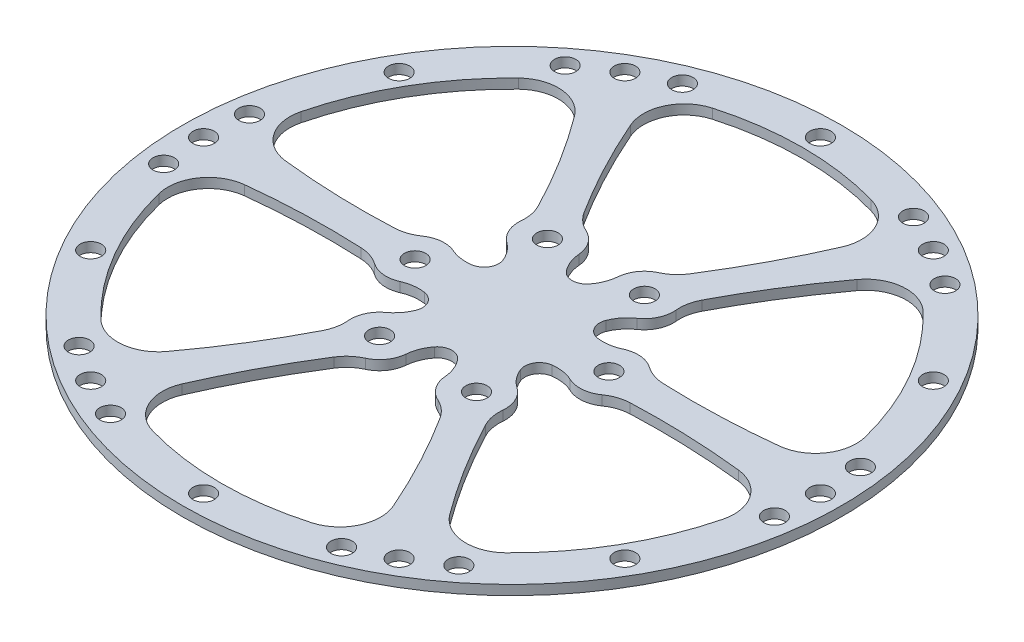
from build123d import *

# Parameters (mm, degrees)
SKETCH1_R           = 34
SKETCH1_R_2         = 1.1
BOSS_EXTRUDE1_DEPTH = 1
CUT_EXTRUDE3_DEPTH  = 1
SKETCH3_R           = 3
SKETCH3_R_2         = 1.1
BOSS_EXTRUDE2_DEPTH = 1
FILLET3_R           = 1.5
FILLET4_R           = 1.5
FILLET5_R           = 1.5
FILLET6_R           = 1.5
FILLET7_R           = 1.5
FILLET8_R           = 1.5
FILLET9_R           = 4.2
FILLET10_DEPTH      = 1
SKETCH4_R           = 1.1
CUT_EXTRUDE5_DEPTH  = 1


with BuildPart() as part:
    # Sketch1 → Boss-Extrude1 (new body)
    with BuildSketch(Plane(origin=(0, 0, 0), x_dir=(1, 0, 0), z_dir=(0, 1, 0))):
        with Locations(Location((0, 0, 0), (0, 0, 270))):
            Circle(SKETCH1_R)
        with BuildLine():
            Line((29.874495302, 2.74126439), (4.752791338, 2.743469217))
            Line((4.752791338, 2.743469217), (17.315552753, 24.498400618))
            ThreePointArc((17.315552753, 24.498400618), (25.982078498, 14.997719724), (29.874495302, 2.74126439))
        make_face(mode=Mode.SUBTRACT)
        with BuildLine():
            Line((12.56324305, 27.242704052), (0.000481633, 5.487772646))
            Line((0.000481633, 5.487772646), (-12.558460911, 27.244908874))
            ThreePointArc((-12.558460911, 27.244908874), (0.002632969, 29.999999884), (12.56324305, 27.242704052))
        make_face(mode=Mode.SUBTRACT)
        with BuildLine():
            Line((-17.311252251, 24.501439661), (-4.752309705, 2.744303429))
            Line((-4.752309705, 2.744303429), (-29.874013664, 2.746508256))
            ThreePointArc((-29.874013664, 2.746508256), (-25.979445529, 15.00228016), (-17.311252251, 24.501439661))
        make_face(mode=Mode.SUBTRACT)
        with BuildLine():
            Line((-29.874495302, -2.74126439), (-4.752791338, -2.743469217))
            Line((-4.752791338, -2.743469217), (-17.315552753, -24.498400618))
            ThreePointArc((-17.315552753, -24.498400618), (-25.982078498, -14.997719724), (-29.874495302, -2.74126439))
        make_face(mode=Mode.SUBTRACT)
        with BuildLine():
            Line((-12.56324305, -27.242704052), (-0.000481633, -5.487772646))
            Line((-0.000481633, -5.487772646), (12.558460911, -27.244908874))
            ThreePointArc((12.558460911, -27.244908874), (-0.002632969, -29.999999884), (-12.56324305, -27.242704052))
        make_face(mode=Mode.SUBTRACT)
        with BuildLine():
            Line((17.311252251, -24.501439661), (4.752309705, -2.744303429))
            Line((4.752309705, -2.744303429), (29.874013664, -2.746508256))
            ThreePointArc((29.874013664, -2.746508256), (25.979445529, -15.00228016), (17.311252251, -24.501439661))
        make_face(mode=Mode.SUBTRACT)
        with Locations(Location((-19.590228091, -25.074348518, 0), (0, 0, 270))):
            Circle(SKETCH1_R_2, mode=Mode.SUBTRACT)
        with Locations(Location((-15.9099025, -27.556759473, 0), (0, 0, 270))):
            Circle(SKETCH1_R_2, mode=Mode.SUBTRACT)
        with Locations(Location((-11.919908754, -29.502809451, 0), (0, 0, 270))):
            Circle(SKETCH1_R_2, mode=Mode.SUBTRACT)
        with Locations(Location((-27.556759473, -15.9099025, 0), (0, 0, 270))):
            Circle(SKETCH1_R_2, mode=Mode.SUBTRACT)
        with Locations(Location((-31.510136845, -4.428460934, 0), (0, 0, 270))):
            Circle(SKETCH1_R_2, mode=Mode.SUBTRACT)
        with Locations(Location((0, -31.819805, 0), (0, 0, 270))):
            Circle(SKETCH1_R_2, mode=Mode.SUBTRACT)
        with Locations(Location((11.919908754, -29.502809451, 0), (0, 0, 270))):
            Circle(SKETCH1_R_2, mode=Mode.SUBTRACT)
        with Locations(Location((15.9099025, -27.556759473, 0), (0, 0, 270))):
            Circle(SKETCH1_R_2, mode=Mode.SUBTRACT)
        with Locations(Location((19.590228091, -25.074348518, 0), (0, 0, 270))):
            Circle(SKETCH1_R_2, mode=Mode.SUBTRACT)
        with Locations(Location((27.556759473, -15.9099025, 0), (0, 0, 270))):
            Circle(SKETCH1_R_2, mode=Mode.SUBTRACT)
        with Locations(Location((31.510136845, -4.428460934, 0), (0, 0, 270))):
            Circle(SKETCH1_R_2, mode=Mode.SUBTRACT)
        with Locations(Location((31.819805, 0, 0), (0, 0, 270))):
            Circle(SKETCH1_R_2, mode=Mode.SUBTRACT)
        with Locations(Location((-31.819805, 0, 0), (0, 0, 270))):
            Circle(SKETCH1_R_2, mode=Mode.SUBTRACT)
        with Locations(Location((-31.510136845, 4.428460934, 0), (0, 0, 270))):
            Circle(SKETCH1_R_2, mode=Mode.SUBTRACT)
        with Locations(Location((-27.556759473, 15.9099025, 0), (0, 0, 270))):
            Circle(SKETCH1_R_2, mode=Mode.SUBTRACT)
        with Locations(Location((-19.590228091, 25.074348518, 0), (0, 0, 270))):
            Circle(SKETCH1_R_2, mode=Mode.SUBTRACT)
        with Locations(Location((-15.9099025, 27.556759473, 0), (0, 0, 270))):
            Circle(SKETCH1_R_2, mode=Mode.SUBTRACT)
        with Locations(Location((-11.919908754, 29.502809451, 0), (0, 0, 270))):
            Circle(SKETCH1_R_2, mode=Mode.SUBTRACT)
        with Locations(Location((0, 31.819805, 0), (0, 0, 270))):
            Circle(SKETCH1_R_2, mode=Mode.SUBTRACT)
        with Locations(Location((27.556759473, 15.9099025, 0), (0, 0, 270))):
            Circle(SKETCH1_R_2, mode=Mode.SUBTRACT)
        with Locations(Location((31.510136845, 4.428460934, 0), (0, 0, 270))):
            Circle(SKETCH1_R_2, mode=Mode.SUBTRACT)
        with Locations(Location((11.919908754, 29.502809451, 0), (0, 0, 270))):
            Circle(SKETCH1_R_2, mode=Mode.SUBTRACT)
        with Locations(Location((19.590228091, 25.074348518, 0), (0, 0, 270))):
            Circle(SKETCH1_R_2, mode=Mode.SUBTRACT)
        with Locations(Location((15.9099025, 27.556759473, 0), (0, 0, 270))):
            Circle(SKETCH1_R_2, mode=Mode.SUBTRACT)
    extrude(amount=BOSS_EXTRUDE1_DEPTH)

    # Sketch2 → Cut-Extrude3 (cut)
    with BuildSketch(Plane(origin=(0, 1, 0), x_dir=(1, 0, 0), z_dir=(0, 1, 0))):
        with BuildLine():
            Line((-29.874013664, 2.746508256), (-17.311252251, 24.501439661))
            add(Edge.make_bspline(
                [(-17.311252251, 24.501439661), (-9.126466195, 14.703908303), (-4.752309705, 2.744303429)],
                knots=[0, 0, 0, 1, 1, 1], degree=2))
            add(Edge.make_bspline(
                [(-29.874013664, 2.746508256), (-17.29686175, 0.57909925), (-4.752309705, 2.744303429)],
                knots=[0, 0, 0, 1, 1, 1], degree=2))
        make_face()
        with BuildLine():
            Line((-12.558460911, 27.244908874), (12.56324305, 27.242704052))
            add(Edge.make_bspline(
                [(12.56324305, 27.242704052), (8.0904088, 15.224614872), (0, 5.31022313)],
                knots=[0, 0, 0, 1, 1, 1], degree=2))
            add(Edge.make_bspline(
                [(-12.558460911, 27.244908874), (-8.092420686, 15.223623734), (0, 5.31022313)],
                knots=[0, 0, 0, 1, 1, 1], degree=2))
        make_face()
        with BuildLine():
            Line((17.315552753, 24.498400618), (29.874495302, 2.74126439))
            add(Edge.make_bspline(
                [(29.874495302, 2.74126439), (17.230107642, 0.605807888), (4.598788131, 2.655111565)],
                knots=[0, 0, 0, 1, 1, 1], degree=2))
            add(Edge.make_bspline(
                [(17.315552753, 24.498400618), (9.137834548, 14.620053759), (4.598788131, 2.655111565)],
                knots=[0, 0, 0, 1, 1, 1], degree=2))
        make_face()
        with BuildLine():
            Line((29.874013664, -2.746508256), (17.311252251, -24.501439661))
            add(Edge.make_bspline(
                [(17.311252251, -24.501439661), (9.139698842, -14.618806983), (4.598788131, -2.655111565)],
                knots=[0, 0, 0, 1, 1, 1], degree=2))
            add(Edge.make_bspline(
                [(29.874013664, -2.746508256), (17.230255234, -0.603569975), (4.598788131, -2.655111565)],
                knots=[0, 0, 0, 1, 1, 1], degree=2))
        make_face()
        with BuildLine():
            Line((12.558460911, -27.244908874), (-12.56324305, -27.242704052))
            add(Edge.make_bspline(
                [(-12.56324305, -27.242704052), (-8.0904088, -15.224614872), (0, -5.31022313)],
                knots=[0, 0, 0, 1, 1, 1], degree=2))
            add(Edge.make_bspline(
                [(12.558460911, -27.244908874), (8.092420686, -15.223623734), (0, -5.31022313)],
                knots=[0, 0, 0, 1, 1, 1], degree=2))
        make_face()
        with BuildLine():
            Line((-17.315552753, -24.498400618), (-29.874495302, -2.74126439))
            add(Edge.make_bspline(
                [(-29.874495302, -2.74126439), (-17.296953851, -0.574908868), (-4.752791338, -2.743469217)],
                knots=[0, 0, 0, 1, 1, 1], degree=2))
            add(Edge.make_bspline(
                [(-17.315552753, -24.498400618), (-9.124043467, -14.705102948), (-4.752791338, -2.743469217)],
                knots=[0, 0, 0, 1, 1, 1], degree=2))
        make_face()
    extrude(amount=-CUT_EXTRUDE3_DEPTH, mode=Mode.SUBTRACT)

    # Sketch3 → Boss-Extrude2 (add)
    # profile 1 of 6: a face of its own
    with BuildSketch(Plane(origin=(0, 1, 0), x_dir=(1, 0, 0), z_dir=(0, 1, 0))):
        with Locations((-10, 0)):
            Circle(SKETCH3_R)
        with Locations((-10, 0)):
            Circle(SKETCH3_R_2, mode=Mode.SUBTRACT)
    # profile 2 of 6: a face of its own
    with BuildSketch(Plane(origin=(0, 1, 0), x_dir=(1, 0, 0), z_dir=(0, 1, 0))):
        with Locations((-5, 8.660254038)):
            Circle(SKETCH3_R)
        with Locations((-5, 8.660254038)):
            Circle(SKETCH3_R_2, mode=Mode.SUBTRACT)
    # profile 3 of 6: a face of its own
    with BuildSketch(Plane(origin=(0, 1, 0), x_dir=(1, 0, 0), z_dir=(0, 1, 0))):
        with Locations((5, 8.660254038)):
            Circle(SKETCH3_R)
        with Locations((5, 8.660254038)):
            Circle(SKETCH3_R_2, mode=Mode.SUBTRACT)
    # profile 4 of 6: a face of its own
    with BuildSketch(Plane(origin=(0, 1, 0), x_dir=(1, 0, 0), z_dir=(0, 1, 0))):
        with Locations((10, 0)):
            Circle(SKETCH3_R)
        with Locations((10, 0)):
            Circle(SKETCH3_R_2, mode=Mode.SUBTRACT)
    # profile 5 of 6: a face of its own
    with BuildSketch(Plane(origin=(0, 1, 0), x_dir=(1, 0, 0), z_dir=(0, 1, 0))):
        with Locations((5, -8.660254038)):
            Circle(SKETCH3_R)
        with Locations((5, -8.660254038)):
            Circle(SKETCH3_R_2, mode=Mode.SUBTRACT)
    # profile 6 of 6: a face of its own
    with BuildSketch(Plane(origin=(0, 1, 0), x_dir=(1, 0, 0), z_dir=(0, 1, 0))):
        with Locations((-5, -8.660254038)):
            Circle(SKETCH3_R)
        with Locations((-5, -8.660254038)):
            Circle(SKETCH3_R_2, mode=Mode.SUBTRACT)
    extrude(amount=-BOSS_EXTRUDE2_DEPTH)

    # Fillet3
    fillet3_edges = [part.edges().sort_by_distance(p)[0] for p in [
        (0, 0.5, 5.31022313),
    ]]
    fillet(fillet3_edges, radius=FILLET3_R)

    # Fillet4
    fillet4_edges = [part.edges().sort_by_distance(p)[0] for p in [
        (4.598788131, 0.5, 2.655111565),
    ]]
    fillet(fillet4_edges, radius=FILLET4_R)

    # Fillet5
    fillet5_edges = [part.edges().sort_by_distance(p)[0] for p in [
        (4.598788131, 0.5, -2.655111565),
    ]]
    fillet(fillet5_edges, radius=FILLET5_R)

    # Fillet6
    fillet6_edges = [part.edges().sort_by_distance(p)[0] for p in [
        (0, 0.5, -5.31022313),
    ]]
    fillet(fillet6_edges, radius=FILLET6_R)

    # Fillet7
    fillet7_edges = [part.edges().sort_by_distance(p)[0] for p in [
        (-4.752309705, 0.5, -2.744303429),
    ]]
    fillet(fillet7_edges, radius=FILLET7_R)

    # Fillet8
    fillet8_edges = [part.edges().sort_by_distance(p)[0] for p in [
        (-4.752791338, 0.5, 2.743469217),
    ]]
    fillet(fillet8_edges, radius=FILLET8_R)

    # Fillet9
    fillet9_edges = [part.edges().sort_by_distance(p)[0] for p in [
        (12.558460911, 0.5, 27.244908874),
        (-17.315552753, 0.5, 24.498400618),
        (29.874013664, 0.5, 2.746508256),
        (-12.56324305, 0.5, 27.242704052),
        (17.311252251, 0.5, 24.501439661),
        (29.874495302, 0.5, -2.74126439),
        (12.56324305, 0.5, -27.242704052),
        (17.315552753, 0.5, -24.498400618),
        (-29.874495302, 0.5, 2.74126439),
        (-29.874013664, 0.5, -2.746508256),
        (-17.311252251, 0.5, -24.501439661),
        (-12.558460911, 0.5, -27.244908874),
    ]]
    fillet(fillet9_edges, radius=FILLET9_R)

    # Fillet10: read off the stored shape, not the designer's step
    # Fillet10 outline → Fillet10 (add)
    with BuildSketch(Plane(origin=(0, 0, 0), x_dir=(1, 0, 0), z_dir=(0, 1, 0))):
        with BuildLine():
            ThreePointArc((-8.415590155, 11.113962409), (-8.046523611, 10.051029707), (-7.988084905, 8.927365629))
            ThreePointArc((-7.988084905, 8.927365629), (-7.911716495, 9.382685386), (-7.76638951, 9.820895704))
            add(Edge.make_bspline(
                [(-7.76638951, 9.820895704), (-8.084685473, 10.471006022), (-8.415590155, 11.113962409)],
                knots=[0.304219548, 0.304219548, 0.304219548, 0.361741967, 0.361741967, 0.361741967], degree=2))
        make_face()
        with BuildLine():
            ThreePointArc((-6.770692858, 6.238550753), (-5.968092704, 5.457492963), (-5.413476899, 4.484549188))
            add(Edge.make_bspline(
                [(-5.413476899, 4.484549188), (-5.677297958, 5.153634548), (-5.953368097, 5.81577003)],
                knots=[0.073240017, 0.073240017, 0.073240017, 0.129936139, 0.129936139, 0.129936139], degree=2))
            ThreePointArc((-5.953368097, 5.81577003), (-6.378337008, 5.995636412), (-6.770692858, 6.238550753))
        make_face()
        with BuildLine():
            ThreePointArc((-13.8176368, -1.742525743), (-12.717335683, -1.952388357), (-11.7183666, -2.459108828))
            ThreePointArc((-11.7183666, -2.459108828), (-12.073739341, -2.167857271), (-12.380467398, -1.82575326))
            add(Edge.make_bspline(
                [(-12.380467398, -1.82575326), (-13.098997429, -1.777039556), (-13.8176368, -1.742525743)],
                knots=[0.303910011, 0.303910011, 0.303910011, 0.36114376, 0.36114376, 0.36114376], degree=2))
        make_face()
        with BuildLine():
            ThreePointArc((-8.018457455, -2.252440708), (-8.385494811, -2.528512012), (-8.790371107, -2.745322921))
            ThreePointArc((-8.790371107, -2.745322921), (-7.713097845, -2.441769395), (-6.593894429, -2.448561738))
            add(Edge.make_bspline(
                [(-6.593894429, -2.448561738), (-7.306122161, -2.34351672), (-8.018457455, -2.252440708)],
                knots=[0.073377691, 0.073377691, 0.073377691, 0.130144231, 0.130144231, 0.130144231], degree=2))
        make_face()
        with BuildLine():
            ThreePointArc((-5.458927414, -12.883083142), (-4.711975614, -12.010677974), (-3.747920555, -11.386477995))
            ThreePointArc((-3.747920555, -11.386477995), (-4.191904081, -11.54936826), (-4.655969204, -11.640462556))
            add(Edge.make_bspline(
                [(-4.655969204, -11.640462556), (-5.063632055, -12.258176868), (-5.458927414, -12.883083142)],
                knots=[0.309108012, 0.309108012, 0.309108012, 0.367577875, 0.367577875, 0.367577875], degree=2))
        make_face()
        with BuildLine():
            ThreePointArc((-2.010703373, -8.913445024), (-1.750899978, -7.795876793), (-1.184532898, -6.798036682))
            add(Edge.make_bspline(
                [(-1.184532898, -6.798036682), (-1.638190767, -7.382198772), (-2.079677281, -7.973438766)],
                knots=[0.074445047, 0.074445047, 0.074445047, 0.132449416, 0.132449416, 0.132449416], degree=2))
            ThreePointArc((-2.079677281, -7.973438766), (-2.008043592, -8.440716216), (-2.010703373, -8.913445024))
        make_face()
        with BuildLine():
            add(Edge.make_bspline(
                [(2.079801781, -7.972909611), (1.63838435, -7.381859851), (1.18477266, -6.797898175)],
                knots=[0.867567266, 0.867567266, 0.867567266, 0.925555655, 0.925555655, 0.925555655], degree=2))
            ThreePointArc((1.18477266, -6.797898175), (1.750993559, -7.795723176), (2.010685154, -8.913229826))
            ThreePointArc((2.010685154, -8.913229826), (2.008071409, -8.44033745), (2.079801781, -7.972909611))
        make_face()
        with BuildLine():
            ThreePointArc((4.65655664, -11.64053031), (4.192314355, -11.549482983), (3.748157463, -11.386586788))
            ThreePointArc((3.748157463, -11.386586788), (4.712574697, -12.010972321), (5.45973176, -12.883734727))
            add(Edge.make_bspline(
                [(5.45973176, -12.883734727), (5.064348265, -12.258526319), (4.65655664, -11.64053031)],
                knots=[0.632384023, 0.632384023, 0.632384023, 0.690878717, 0.690878717, 0.690878717], degree=2))
        make_face()
        with BuildLine():
            ThreePointArc((8.427613573, -11.169111389), (8.045564435, -10.08602957), (7.987018926, -8.939033409))
            ThreePointArc((7.987018926, -8.939033409), (7.90609427, -9.404979554), (7.752951683, -9.852418888))
            add(Edge.make_bspline(
                [(7.752951683, -9.852418888), (8.084076544, -10.514322429), (8.427613573, -11.169111389)],
                knots=[0.309108012, 0.309108012, 0.309108012, 0.367577875, 0.367577875, 0.367577875], degree=2))
        make_face()
        with BuildLine():
            ThreePointArc((6.71391814, -6.198042713), (5.875977358, -5.414262257), (5.295006014, -4.424853922))
            add(Edge.make_bspline(
                [(5.295006014, -4.424853922), (5.574076289, -5.109814206), (5.865361886, -5.78777274)],
                knots=[0.074445047, 0.074445047, 0.074445047, 0.132449416, 0.132449416, 0.132449416], degree=2))
            ThreePointArc((5.865361886, -5.78777274), (6.305852873, -5.959374871), (6.71391814, -6.198042713))
        make_face()
        with BuildLine():
            add(Edge.make_bspline(
                [(7.944643156, -2.185293628), (7.212070333, -2.272047457), (6.479538842, -2.372905867)],
                knots=[0.867567266, 0.867567266, 0.867567266, 0.925555655, 0.925555655, 0.925555655], degree=2))
            ThreePointArc((6.479538842, -2.372905867), (7.62679109, -2.381456684), (8.724426036, -2.715310491))
            ThreePointArc((8.724426036, -2.715310491), (8.313582353, -2.481127872), (7.944643156, -2.185293628))
        make_face()
        with BuildLine():
            ThreePointArc((12.409273282, -1.78756881), (12.098302841, -2.14409076), (11.735152152, -2.447293814))
            ThreePointArc((11.735152152, -2.447293814), (12.758094502, -1.924276756), (13.887507449, -1.713600962))
            add(Edge.make_bspline(
                [(13.887507449, -1.713600962), (13.148369337, -1.743408908), (12.409273282, -1.78756881)],
                knots=[0.632384023, 0.632384023, 0.632384023, 0.690878717, 0.690878717, 0.690878717], degree=2))
        make_face()
        with BuildLine():
            ThreePointArc((13.886540987, 1.713971753), (12.757540049, 1.924648403), (11.734939481, 2.447444585))
            ThreePointArc((11.734939481, 2.447444585), (12.097998351, 2.144388705), (12.408920887, 1.788043668))
            add(Edge.make_bspline(
                [(12.408920887, 1.788043668), (13.147708599, 1.743854439), (13.886540987, 1.713971753)],
                knots=[0.309108012, 0.309108012, 0.309108012, 0.367577875, 0.367577875, 0.367577875], degree=2))
        make_face()
        with BuildLine():
            ThreePointArc((8.724621513, 2.715402312), (7.626877337, 2.381614536), (6.479538912, 2.37318276))
            add(Edge.make_bspline(
                [(6.479538912, 2.37318276), (7.212267056, 2.272384566), (7.945039167, 2.185666026)],
                knots=[0.074445047, 0.074445047, 0.074445047, 0.132449416, 0.132449416, 0.132449416], degree=2))
            ThreePointArc((7.945039167, 2.185666026), (8.313896465, 2.481341345), (8.724621513, 2.715402312))
        make_face()
        with BuildLine():
            ThreePointArc((5.294766182, 4.424992308), (5.875797531, 5.414266492), (6.713740882, 6.197919335))
            ThreePointArc((6.713740882, 6.197919335), (6.305510944, 5.959209578), (5.864841375, 5.787615983))
            add(Edge.make_bspline(
                [(5.864841375, 5.787615983), (5.573685983, 5.109812394), (5.294766182, 4.424992308)],
                knots=[0.867567266, 0.867567266, 0.867567266, 0.925555655, 0.925555655, 0.925555655], degree=2))
        make_face()
        with BuildLine():
            ThreePointArc((7.986994689, 8.939292974), (8.045519806, 10.086695565), (8.427775689, 11.170133766))
            add(Edge.make_bspline(
                [(8.427775689, 11.170133766), (8.084021073, 10.515117411), (7.752716642, 9.8529615)],
                knots=[0.632384023, 0.632384023, 0.632384023, 0.690878717, 0.690878717, 0.690878717], degree=2))
            ThreePointArc((7.752716642, 9.8529615), (7.905988487, 9.405392224), (7.986994689, 8.939292974))
        make_face()
        with BuildLine():
            add(Edge.make_bspline(
                [(-2.079801781, 7.972909611), (-1.63838435, 7.381859851), (-1.18477266, 6.797898175)],
                knots=[0.867567266, 0.867567266, 0.867567266, 0.925555655, 0.925555655, 0.925555655], degree=2))
            ThreePointArc((-1.18477266, 6.797898175), (-1.750993559, 7.795723176), (-2.010685154, 8.913229826))
            ThreePointArc((-2.010685154, 8.913229826), (-2.008071409, 8.44033745), (-2.079801781, 7.972909611))
        make_face()
        with BuildLine():
            ThreePointArc((-4.65655664, 11.64053031), (-4.192314355, 11.549482983), (-3.748157463, 11.386586788))
            ThreePointArc((-3.748157463, 11.386586788), (-4.712574697, 12.010972321), (-5.45973176, 12.883734727))
            add(Edge.make_bspline(
                [(-5.45973176, 12.883734727), (-5.064348265, 12.258526319), (-4.65655664, 11.64053031)],
                knots=[0.632384023, 0.632384023, 0.632384023, 0.690878717, 0.690878717, 0.690878717], degree=2))
        make_face()
        with BuildLine():
            ThreePointArc((-5.413204357, -4.483013254), (-5.967844295, -5.456905927), (-6.770895812, -6.238699161))
            ThreePointArc((-6.770895812, -6.238699161), (-6.3784821, -5.995711469), (-5.953439481, -5.815793956))
            add(Edge.make_bspline(
                [(-5.953439481, -5.815793956), (-5.677168993, -5.152895938), (-5.413204357, -4.483013254)],
                knots=[0.87004517, 0.87004517, 0.87004517, 0.926800876, 0.926800876, 0.926800876], degree=2))
        make_face()
        with BuildLine():
            ThreePointArc((-7.988068151, -8.92755298), (-8.046484532, -10.051466925), (-8.4156659, -11.114622675))
            add(Edge.make_bspline(
                [(-8.4156659, -11.114622675), (-8.084633361, -10.471517015), (-7.766247989, -9.821232962)],
                knots=[0.638220183, 0.638220183, 0.638220183, 0.695757597, 0.695757597, 0.695757597], degree=2))
            ThreePointArc((-7.766247989, -9.821232962), (-7.911649797, -9.382954157), (-7.988068151, -8.92755298))
        make_face()
        with BuildLine():
            ThreePointArc((-6.597223562, 2.449322925), (-7.715169363, 2.442699462), (-8.791283799, 2.745724885))
            ThreePointArc((-8.791283799, 2.745724885), (-8.386817465, 2.529356067), (-8.020065274, 2.25385414))
            add(Edge.make_bspline(
                [(-8.020065274, 2.25385414), (-7.308592022, 2.344624948), (-6.597223562, 2.449322925)],
                knots=[0.86977603, 0.86977603, 0.86977603, 0.926472559, 0.926472559, 0.926472559], degree=2))
        make_face()
        with BuildLine():
            ThreePointArc((-12.378329092, 1.828537866), (-12.07161502, 2.169887372), (-11.716426765, 2.4604632))
            ThreePointArc((-11.716426765, 2.4604632), (-12.71458873, 1.954941655), (-13.813715315, 1.745656945))
            add(Edge.make_bspline(
                [(-13.813715315, 1.745656945), (-13.095968943, 1.780018973), (-12.378329092, 1.828537866)],
                knots=[0.639000375, 0.639000375, 0.639000375, 0.696162532, 0.696162532, 0.696162532], degree=2))
        make_face()
        with BuildLine():
            ThreePointArc((5.458927414, 12.883083142), (4.711975614, 12.010677974), (3.747920555, 11.386477995))
            ThreePointArc((3.747920555, 11.386477995), (4.191904081, 11.54936826), (4.655969204, 11.640462556))
            add(Edge.make_bspline(
                [(4.655969204, 11.640462556), (5.063632055, 12.258176868), (5.458927414, 12.883083142)],
                knots=[0.309108012, 0.309108012, 0.309108012, 0.367577875, 0.367577875, 0.367577875], degree=2))
        make_face()
        with BuildLine():
            ThreePointArc((2.010703373, 8.913445024), (1.750899978, 7.795876793), (1.184532898, 6.798036682))
            add(Edge.make_bspline(
                [(1.184532898, 6.798036682), (1.638190767, 7.382198772), (2.079677281, 7.973438766)],
                knots=[0.074445047, 0.074445047, 0.074445047, 0.132449416, 0.132449416, 0.132449416], degree=2))
            ThreePointArc((2.079677281, 7.973438766), (2.008043592, 8.440716216), (2.010703373, 8.913445024))
        make_face()
    extrude(amount=FILLET10_DEPTH)

    # Sketch4 → Cut-Extrude5 (cut)
    with BuildSketch(Plane(origin=(0, 1, 0), x_dir=(1, 0, 0), z_dir=(0, 1, 0))):
        with Locations(Location((-10, 0, 0), (0, 0, 270))):
            Circle(SKETCH4_R)
        with Locations(Location((-5, 8.660254038, 0), (0, 0, 270))):
            Circle(SKETCH4_R)
        with Locations(Location((5, 8.660254038, 0), (0, 0, 270))):
            Circle(SKETCH4_R)
        with Locations(Location((10, 0, 0), (0, 0, 270))):
            Circle(SKETCH4_R)
        with Locations(Location((5, -8.660254038, 0), (0, 0, 270))):
            Circle(SKETCH4_R)
        with Locations(Location((-5, -8.660254038, 0), (0, 0, 270))):
            Circle(SKETCH4_R)
    extrude(amount=-CUT_EXTRUDE5_DEPTH, mode=Mode.SUBTRACT)


solid = part.part
